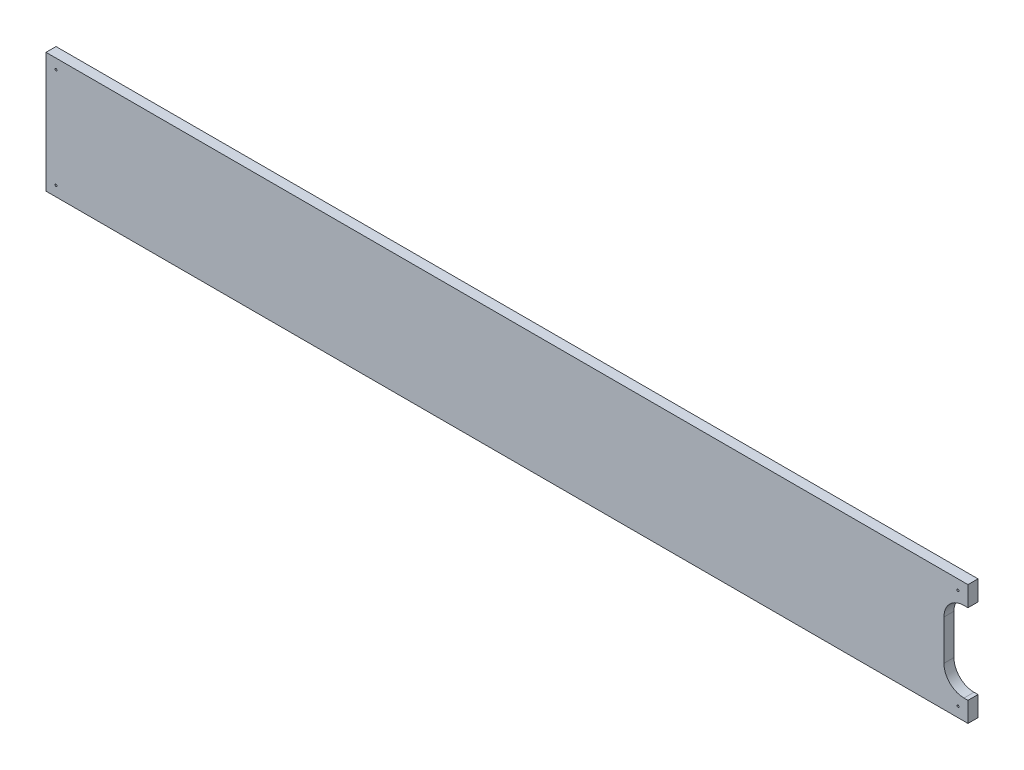
from build123d import *

# Parameters (mm, degrees)
ESQUISSE1_W                   = 460
ESQUISSE1_H                   = 60
BOSS_EXTRU_1_DEPTH            = 5
DIAM_TRE_DU_PER_AGE_1_0_1_1_D = 1
ENL_V_MAT_EXTRU_1_REACH       = 465.923


with BuildPart() as part:
    # Esquisse1 → Boss.-Extru.1 (new body)
    with BuildSketch(Plane.XY):
        with Locations((230, 30)):
            Rectangle(ESQUISSE1_W, ESQUISSE1_H)
    extrude(amount=BOSS_EXTRU_1_DEPTH)

    # Diamètre du perçage Ø1.0 (1)1 (through all)
    with Locations(Plane.XY.offset(5)):
        with Locations((5, 55), (5, 5), (455, 5), (455, 55)):
            Hole(DIAM_TRE_DU_PER_AGE_1_0_1_1_D / 2)

    # Esquisse4 → Enlèv. mat.-Extru.1 (cut, up to next)
    with BuildSketch(Plane.XY.offset(5), mode=Mode.PRIVATE) as enl_v_mat_extru_1_sk1:
        with BuildLine():
            Line((460, 50), (458, 50))
            ThreePointArc((458, 50), (450.928932188, 47.071067812), (448, 40))
            Line((448, 40), (448, 20))
            ThreePointArc((448, 20), (450.928932188, 12.928932188), (458, 10))
            Line((458, 10), (460, 10))
            Line((460, 10), (460, 50))
        make_face()
    enl_v_mat_extru_1_tool1 = extrude(enl_v_mat_extru_1_sk1.sketch, amount=-ENL_V_MAT_EXTRU_1_REACH, mode=Mode.PRIVATE) & part.part
    add(enl_v_mat_extru_1_tool1.solids().sort_by_distance((454.369845, 30, 5))[0], mode=Mode.SUBTRACT)


solid = part.part
